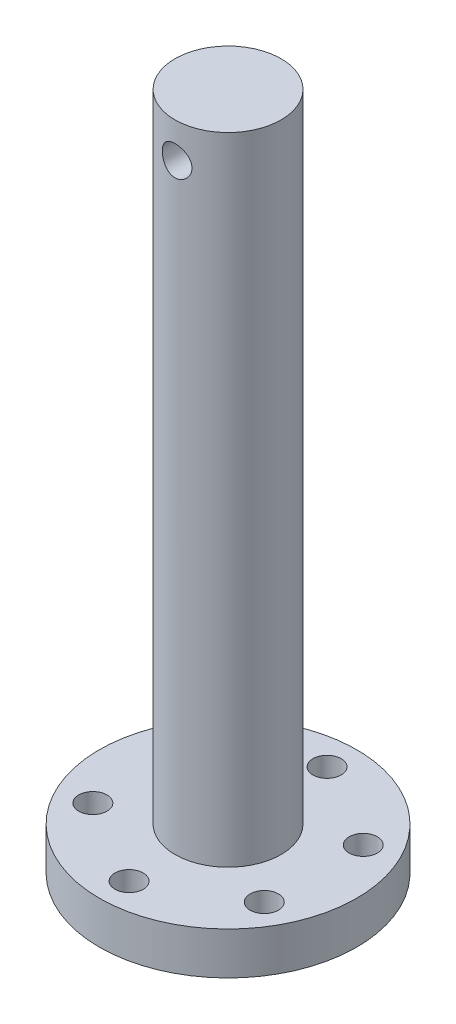
from build123d import *

# Parameters (mm, degrees)
SKETCH1_R           = 18.2
BOSS_EXTRUDE1_DEPTH = 6
SKETCH3_R           = 2
CUT_EXTRUDE1_DEPTH  = 10
CIRPATTERN1_COUNT   = 6
SKETCH4_R           = 7.5
BOSS_EXTRUDE2_DEPTH = 90
SKETCH9_R           = 2.1
CUT_EXTRUDE2_DEPTH  = 102.033311338


with BuildPart() as part:
    # Sketch1 → Boss-Extrude1 (new body)
    with BuildSketch(Plane(origin=(0, 0, 0), x_dir=(1, 0, 0), z_dir=(0, 1, 0))):
        Circle(SKETCH1_R)
    extrude(amount=BOSS_EXTRUDE1_DEPTH)

    # Sketch3 → Cut-Extrude1 (cut)
    with BuildSketch(Plane(origin=(0, 6, 0), x_dir=(1, 0, 0), z_dir=(0, 1, 0))):
        with Locations((0, 14)):
            Circle(SKETCH3_R)
    cut_extrude1 = extrude(amount=-CUT_EXTRUDE1_DEPTH, mode=Mode.SUBTRACT)

    # CirPattern1: Cut-Extrude1 ×6 about axis
    cirpattern1_axis = Axis((0, 6, 0), (0, 1, 0))
    for i in range(1, CIRPATTERN1_COUNT):
        add(cut_extrude1.rotate(cirpattern1_axis, i * 360 / CIRPATTERN1_COUNT), mode=Mode.SUBTRACT)

    # Sketch4 → Boss-Extrude2 (add)
    with BuildSketch(Plane(origin=(0, 6, 0), x_dir=(1, 0, 0), z_dir=(0, 1, 0))):
        Circle(SKETCH4_R)
    extrude(amount=BOSS_EXTRUDE2_DEPTH)

    # Sketch9 → Cut-Extrude2 (cut, through all)
    with BuildSketch(Plane(origin=(0, 0, -7.5), x_dir=(-1, 0, 0), z_dir=(0, 0, -1))):
        with Locations((0, 91)):
            Circle(SKETCH9_R)
    extrude(amount=-CUT_EXTRUDE2_DEPTH, mode=Mode.SUBTRACT)


solid = part.part
